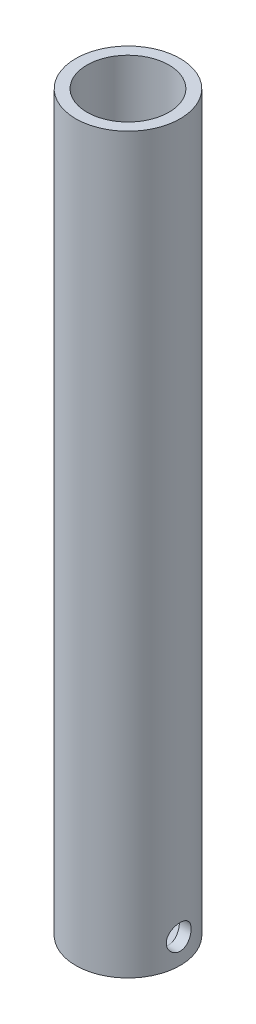
from build123d import *

# Parameters (mm, degrees)
SKETCH1_R           = 13.335
SKETCH1_R_2         = 10.4648
BOSS_EXTRUDE1_DEPTH = 187.325
SKETCH1_2_R         = 10.4648
BOSS_EXTRUDE2_DEPTH = 3.175
SKETCH3_R           = 3.175
CUT_EXTRUDE1_DEPTH  = 14.351


with BuildPart() as part:
    # Sketch1 → Boss-Extrude1 (new body)
    with BuildSketch(Plane(origin=(0, 0, 0), x_dir=(1, 0, 0), z_dir=(0, 1, 0))):
        Circle(SKETCH1_R)
        Circle(SKETCH1_R_2, mode=Mode.SUBTRACT)
    extrude(amount=BOSS_EXTRUDE1_DEPTH)

    # Sketch1<2> → Boss-Extrude2 (add)
    with BuildSketch(Plane(origin=(0, 0, 0), x_dir=(1, 0, 0), z_dir=(0, 1, 0))):
        Circle(SKETCH1_2_R)
    extrude(amount=BOSS_EXTRUDE2_DEPTH)

    # Sketch3 → Cut-Extrude1 (cut)
    with BuildSketch(Plane(origin=(13.335, 0, 0), x_dir=(0, 0, -1), z_dir=(1, 0, 0))):
        with Locations((0, 6.35)):
            Circle(SKETCH3_R)
    extrude(amount=-CUT_EXTRUDE1_DEPTH, mode=Mode.SUBTRACT)


solid = part.part
